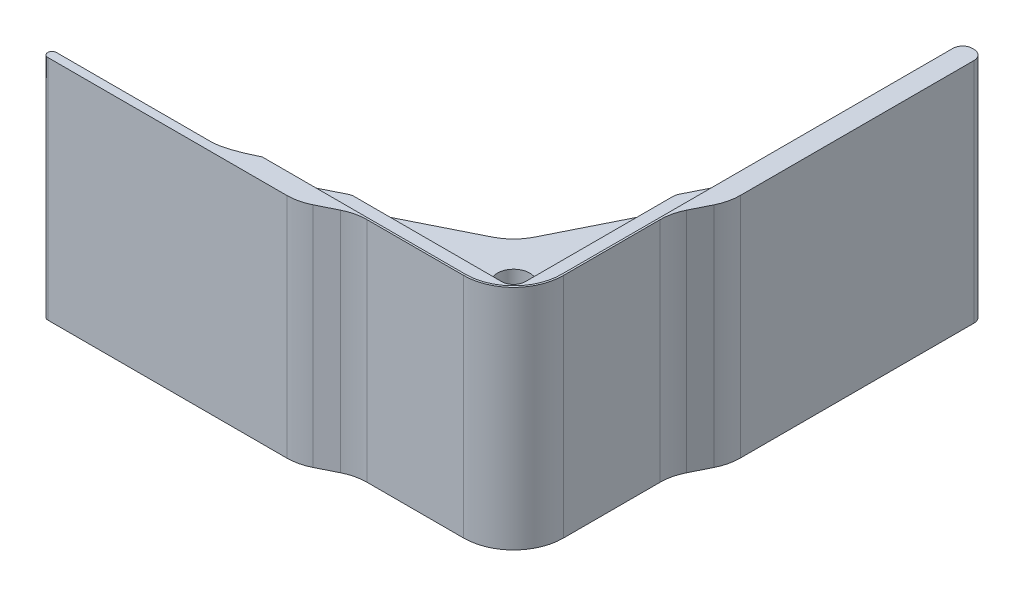
from build123d import *
from build123d.topology import SkipClean

# Parameters (mm, degrees)
SKETCH1_R           = 4.28625
BOSS_EXTRUDE1_DEPTH = 50.8
FILLET8_R           = 12.7
SKETCH2_W           = 42.1132
SKETCH2_H           = 3.302
CUT_EXTRUDE1_DEPTH  = 159.782890609
FILLET3_R           = 2.54
FILLET6_RADIUS      = 1.143
FILLET6_LENGTH      = 50.8
BOSS_EXTRUDE2_DEPTH = 30.1625
CUT_EXTRUDE2_DEPTH  = 163.081683202
FILLET7_R           = 12.7
SKETCH7_W           = 42.968170869
SKETCH7_H           = 42.968170869
CUT_EXTRUDE3_DEPTH  = 3.429
FILLET9_R           = 3.175


with BuildPart() as part:
    # Sketch1 → Boss-Extrude1 (new body)
    with BuildSketch(Plane(origin=(0, 0, 0), x_dir=(1, 0, 0), z_dir=(0, 1, 0))):
        with BuildLine():
            Line((12.7, 53.934971632), (-9.469611004, 9.469611004))
            Line((-9.469611004, 9.469611004), (-53.934971632, -12.7))
            Line((-53.934971632, -12.7), (-106.3752, -12.7))
            Line((-106.3752, -12.7), (-106.3752, -18.288))
            Line((-106.3752, -18.288), (0, -18.288))
            ThreePointArc((0, -18.288), (12.931568814, -12.931568814), (18.288, 0))
            Line((18.288, 0), (18.288, 106.3752))
            Line((18.288, 106.3752), (12.7, 106.3752))
            Line((12.7, 106.3752), (12.7, 53.934971632))
        make_face()
        with Locations(Location((0, 0, 0), (0, 0, 270))):
            Circle(SKETCH1_R, mode=Mode.SUBTRACT)
    extrude(amount=BOSS_EXTRUDE1_DEPTH)

    # Fillet8
    fillet8_edges = [part.edges().sort_by_distance(p)[0] for p in [
        (12.7, 25.4, -53.934971632),
        (-9.469611004, 25.4, -9.469611004),
    ]]
    fillet(fillet8_edges, radius=FILLET8_R)

    # Sketch2 → Cut-Extrude1 (cut, through all)
    with BuildSketch(Plane(origin=(0, 50.8, 0), x_dir=(1, 0, 0), z_dir=(0, 1, 0))):
        with Locations((-85.3186, -14.351)):
            Rectangle(SKETCH2_W, SKETCH2_H)
        with BuildLine():
            Line((-53.934971632, -12.7), (-64.262, -12.7))
            Line((-64.262, -12.7), (-64.262, -16.002))
            add(Edge.make_bspline(
                [(-53.934971632, -12.7), (-60.557759049, -16.002), (-64.262, -16.002)],
                knots=[0, 0, 0, 1, 1, 1], degree=2))
        make_face()
    extrude(amount=-CUT_EXTRUDE1_DEPTH, mode=Mode.SUBTRACT)

    # Fillet3
    fillet3_edges = [part.edges().sort_by_distance(p)[0] for p in [
        (12.7, 25.4, -106.3752),
        (18.288, 25.4, -106.3752),
    ]]
    fillet(fillet3_edges, radius=FILLET3_R)

    # Fillet6: full round fillet: the end face becomes a half cylinder, R = half its width
    fillet6_face = Plane((-106.3752, 25.4, 17.145), x_dir=(0, 1, 0), z_dir=(-1, 0, 0))  # on the end face: x along it, z out of the body
    fillet6_slab = fillet6_face.offset(-FILLET6_RADIUS / 2) * Box(FILLET6_LENGTH, 2 * FILLET6_RADIUS, FILLET6_RADIUS, mode=Mode.PRIVATE)  # the body's end, R deep
    fillet6_round = Plane((-105.2322, 25.4, 17.145), x_dir=(-1, 0, 0), z_dir=(0, 1, 0)) * Cylinder(FILLET6_RADIUS, FILLET6_LENGTH, mode=Mode.PRIVATE)  # its axis R under the face
    add(fillet6_slab - fillet6_round, mode=Mode.SUBTRACT)

    # Sketch3 → Boss-Extrude2 (add, symmetric)
    with SkipClean():  # the faces are left unmerged after this step: merging them gives an invalid solid
        with BuildSketch(Plane(origin=(0, 25.4, 0), x_dir=(1, 0, 0), z_dir=(0, 1, 0))):
            with BuildLine():
                Line((15.748, 106.3752), (15.24, 106.3752))
                ThreePointArc((15.24, 106.3752), (13.443948776, 105.631251224), (12.7, 103.8352))
                Line((12.7, 103.8352), (12.7, 0))
                ThreePointArc((12.7, 0), (8.980256121, -8.980256121), (0, -12.7))
                Line((0, -12.7), (-53.934971632, -12.7))
                add(Edge.make_bspline(
                    [(-53.934971632, -12.7), (-60.557759049, -16.002), (-64.262, -16.002)],
                    knots=[0, 0, 0, 1, 1, 1], degree=2))
                Line((-64.262, -16.002), (-105.2322, -16.002))
                ThreePointArc((-105.2322, -16.002), (-106.3752, -17.145), (-105.2322, -18.288))
                Line((-105.2322, -18.288), (0, -18.288))
                ThreePointArc((0, -18.288), (12.931568814, -12.931568814), (18.288, 0))
                Line((18.288, 0), (18.288, 103.8352))
                ThreePointArc((18.288, 103.8352), (17.544051224, 105.631251224), (15.748, 106.3752))
            make_face()
        extrude(amount=BOSS_EXTRUDE2_DEPTH, both=True)
    add(part.part.scale(1), mode=Mode.REPLACE)  # the faces are merged on a copy

    # Sketch6 → Cut-Extrude2 (cut, through all)
    with BuildSketch(Plane(origin=(0, 55.5625, 0), x_dir=(1, 0, 0), z_dir=(0, 1, 0))):
        with BuildLine():
            Line((-38.862, -18.288), (0, -18.288))
            ThreePointArc((0, -18.288), (12.931568814, -12.931568814), (18.288, 0))
            Line((18.288, 0), (18.288, 38.862))
            Line((18.288, 38.862), (13.208, 28.673096282))
            Line((13.208, 28.673096282), (13.208, 0))
            ThreePointArc((13.208, 0), (9.339466366, -9.339466366), (0, -13.208))
            Line((0, -13.208), (-28.673096282, -13.208))
            Line((-28.673096282, -13.208), (-38.862, -18.288))
        make_face()
    extrude(amount=-CUT_EXTRUDE2_DEPTH, mode=Mode.SUBTRACT)

    # Fillet7
    fillet7_edges = [part.edges().sort_by_distance(p)[0] for p in [
        (13.208, 25.4, -28.673096282),
        (18.288, 25.4, -38.862),
        (-38.862, 25.4, 18.288),
        (-28.673096282, 25.4, 13.208),
    ]]
    fillet(fillet7_edges, radius=FILLET7_R)

    # Sketch7 → Cut-Extrude3 (cut)
    with BuildSketch(Plane(origin=(0, 50.8, 0), x_dir=(1, 0, 0), z_dir=(0, 1, 0))):
        with Locations((-16.658085435, 16.658085435)):
            Rectangle(SKETCH7_W, SKETCH7_H)
    extrude(amount=-CUT_EXTRUDE3_DEPTH, mode=Mode.SUBTRACT)

    # Fillet9
    fillet9_edges = [part.edges().sort_by_distance(p)[0] for p in [
        (4.826, 49.0855, -38.142170869),
        (4.826, 49.0855, 4.826),
        (-38.142170869, 49.0855, 4.826),
    ]]
    fillet(fillet9_edges, radius=FILLET9_R)


solid = part.part
